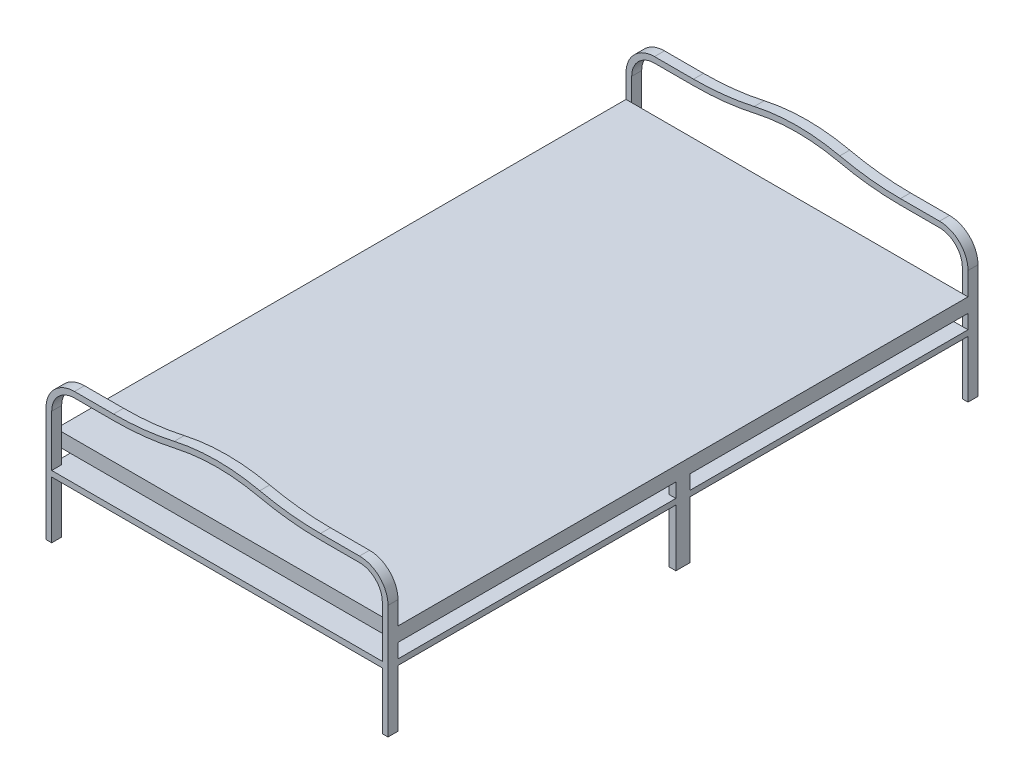
from build123d import *

# Parameters (mm, degrees)
SKETCH_1_W         = 1200
SKETCH_1_H         = 2000
EXTRUDE_1_DEPTH    = 50
SKETCH_2_W         = 25
SKETCH_2_H         = 50
EXTRUDE_2_DEPTH    = 320
EXTRUDE_1_2_DEPTH  = 35
SKETCH_4_W         = 1200
SKETCH_4_H         = 20
EXTRUDE_3_DEPTH    = 35
MIRROR_START       = -1000
MIRROR_2_OUTLINE_W = 1200
MIRROR_2_OUTLINE_H = 20
MIRROR_2_DEPTH     = 2000
MIRROR_START_2     = -1035
MIRROR_2_2_DEPTH   = 35


# Read off the part's stored shape, not the designer's step: 镜向2
with BuildPart() as part:
    # 草图1 → Extrude 1 (new body)
    with BuildSketch(Plane(origin=(0, 0, 0), x_dir=(1, 0, 0), z_dir=(0, 1, 0))):
        Rectangle(SKETCH_1_W, SKETCH_1_H)
    extrude(amount=-EXTRUDE_1_DEPTH)

    # 草图2 → 凸台-拉伸2 (add)
    with BuildSketch(Plane(origin=(0, 0, 0), x_dir=(1, 0, 0), z_dir=(0, 1, 0))):
        with Locations((-587.5, 0)):
            Rectangle(SKETCH_2_W, SKETCH_2_H)
    extrude_2 = extrude(amount=-EXTRUDE_2_DEPTH)

    # 镜向1: 凸台-拉伸2 across plane
    add(extrude_2.mirror(Plane(origin=(0, 0, 0), x_dir=(0, 0, 1), z_dir=(1, 0, 0))))

    # 草图3 → Extrude 1 2 (add)
    with BuildSketch(Plane.XY.offset(1000)):
        with BuildLine():
            Line((-600, -320), (-600, 80))
            ThreePointArc((-600, 80), (-570.710678119, 150.710678119), (-500, 180))
            Line((-500, 180), (-363.0422981, 180))
            ThreePointArc((-363.0422981, 180), (-255.876535707, 185.885952353), (-150, 203.473000167))
            ThreePointArc((-150, 203.473000167), (0, 220), (150, 203.473000167))
            ThreePointArc((150, 203.473000167), (255.876535707, 185.885952353), (363.0422981, 180))
            Line((363.0422981, 180), (500, 180))
            ThreePointArc((500, 180), (570.710678119, 150.710678119), (600, 80))
            Line((600, 80), (600, -320))
            Line((600, -320), (580, -320))
            Line((580, -320), (580, 80))
            ThreePointArc((580, 80), (556.568542495, 136.568542495), (500, 160))
            Line((500, 160), (363.0422981, 160))
            ThreePointArc((363.0422981, 160), (253.686190615, 166.006254459), (145.645660129, 183.952761329))
            ThreePointArc((145.645660129, 183.952761329), (0, 200), (-145.645660129, 183.952761329))
            ThreePointArc((-145.645660129, 183.952761329), (-253.686190615, 166.006254459), (-363.0422981, 160))
            Line((-363.0422981, 160), (-500, 160))
            ThreePointArc((-500, 160), (-556.568542495, 136.568542495), (-580, 80))
            Line((-580, 80), (-580, -320))
            Line((-580, -320), (-600, -320))
        make_face()
    extrude(amount=EXTRUDE_1_2_DEPTH)

    # 草图4 → 拉伸-薄壁3 (add)
    with BuildSketch(Plane.XY.offset(1000)):
        with Locations((0, -110)):
            Rectangle(SKETCH_4_W, SKETCH_4_H)
    extrude(amount=EXTRUDE_3_DEPTH)

    # 镜向2 outline → 镜向2 (add)
    with BuildSketch(Plane.XY.offset(MIRROR_START)):
        with Locations((0, -110)):
            Rectangle(MIRROR_2_OUTLINE_W, MIRROR_2_OUTLINE_H)
    extrude(amount=MIRROR_2_DEPTH)

    # Mirror 2 2 outline → Mirror 2 2 (add)
    with BuildSketch(Plane.XY.offset(MIRROR_START_2)):
        with BuildLine():
            ThreePointArc((-580, 80), (-556.568542495, 136.568542495), (-500, 160))
            Line((-500, 160), (-363.0422981, 160))
            ThreePointArc((-363.0422981, 160), (-253.686190616, 166.006254459), (-145.645660129, 183.952761329))
            ThreePointArc((-145.645660129, 183.952761329), (0, 200), (145.645660129, 183.952761329))
            ThreePointArc((145.645660129, 183.952761329), (253.686190616, 166.006254459), (363.0422981, 160))
            Line((363.0422981, 160), (500, 160))
            ThreePointArc((500, 160), (556.568542495, 136.568542495), (580, 80))
            Line((580, 80), (580, -320))
            Line((580, -320), (600, -320))
            Line((600, -320), (600, 80))
            ThreePointArc((600, 80), (570.710678119, 150.710678119), (500, 180))
            Line((500, 180), (363.0422981, 180))
            ThreePointArc((363.0422981, 180), (255.876535708, 185.885952353), (150, 203.473000167))
            ThreePointArc((150, 203.473000167), (0, 220), (-150, 203.473000167))
            ThreePointArc((-150, 203.473000167), (-255.876535708, 185.885952353), (-363.0422981, 180))
            Line((-363.0422981, 180), (-500, 180))
            ThreePointArc((-500, 180), (-570.710678119, 150.710678119), (-600, 80))
            Line((-600, 80), (-600, -320))
            Line((-600, -320), (-580, -320))
            Line((-580, -320), (-580, 80))
        make_face()
    extrude(amount=MIRROR_2_2_DEPTH)


solid = part.part
